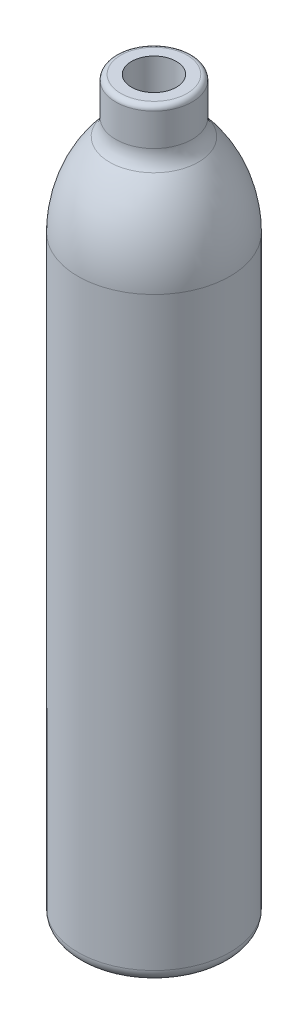
from build123d import *


# Read off the part's stored shape, not the designer's step: 抽壳1
with BuildPart() as part:
    # 草图1 → 旋转1 (revolve)
    with BuildSketch(Plane.XY, mode=Mode.PRIVATE) as revolve_1_sk:
        with BuildLine():
            Line((0, 129.302861252), (0, -165.697138748))
            Line((0, -165.697138748), (25.5, -165.697138748))
            ThreePointArc((25.5, -165.697138748), (29.035533906, -164.232672654), (30.5, -160.697138748))
            Line((30.5, -160.697138748), (30.5, 74.302861252))
            ThreePointArc((30.5, 74.302861252), (27.22407628, 92.146010239), (17.823593149, 107.661826649))
            ThreePointArc((17.823593149, 107.661826649), (15.952164194, 110.750683646), (15.3, 114.302861252))
            Line((15.3, 114.302861252), (15.3, 127.302861252))
            ThreePointArc((15.3, 127.302861252), (14.714213562, 128.717074815), (13.3, 129.302861252))
            Line((13.3, 129.302861252), (0, 129.302861252))
        make_face()
    revolve(revolve_1_sk.sketch.rotate(Axis((0, 129.302861252, 0), (0, -1, 0)), 180), axis=Axis((0, 129.302861252, 0), (0, -1, 0)))

    # 抽壳1 outline → 抽壳1 (revolve, cut)
    with BuildSketch(Plane.XY):
        with BuildLine():
            Line((0, -159.397138748), (24.2, -159.397138748))
            Line((24.2, -159.397138748), (24.2, 74.302861252))
            ThreePointArc((24.2, 74.302861252), (21.334939722, 89.908138347), (13.113456833, 103.477974849))
            ThreePointArc((13.113456833, 103.477974849), (10.063027636, 108.512811754), (9, 114.302861252))
            Line((9, 114.302861252), (9, 129.302861252))
            Line((9, 129.302861252), (0, 129.302861252))
            Line((0, 129.302861252), (0, -159.397138748))
        make_face()
    revolve(axis=Axis((0, 0, 0), (0, 1, 0)), mode=Mode.SUBTRACT)


solid = part.part
